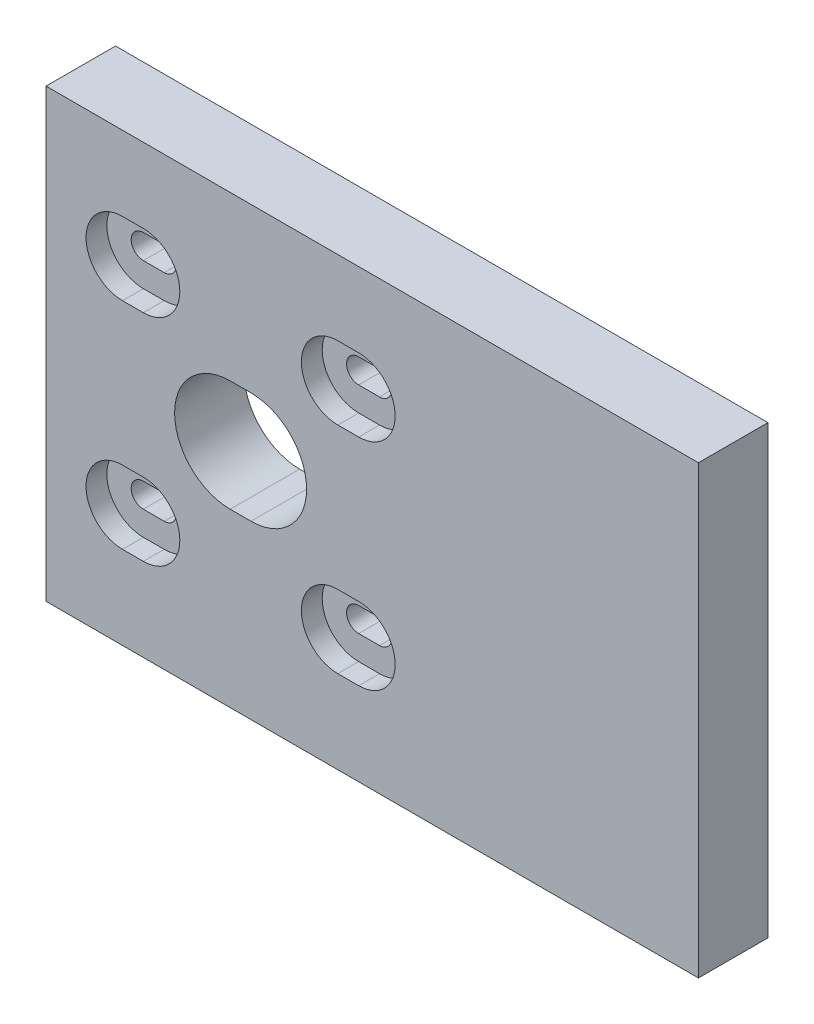
from build123d import *

# Parameters (mm, degrees)
SKETCH1_W           = 93.911938319
SKETCH1_H           = 64.237222829
BOSS_EXTRUDE1_DEPTH = 10
CUT_EXTRUDE1_DEPTH  = 20
CUT_EXTRUDE2_DEPTH  = 3


with BuildPart() as part:
    # Sketch1 → Boss-Extrude1 (new body)
    with BuildSketch(Plane.XY):
        with Locations((-3.99305407, -0.113373268)):
            Rectangle(SKETCH1_W, SKETCH1_H)
    extrude(amount=BOSS_EXTRUDE1_DEPTH)

    # Sketch2 → Cut-Extrude1 (cut)
    with BuildSketch(Plane.XY.offset(10)):
        with BuildLine():
            Line((-39.949023229, 17.755238146), (-36.949023229, 17.755238146))
            ThreePointArc((-36.949023229, 17.755238146), (-35.199023229, 16.005238146), (-36.949023229, 14.255238146))
            Line((-36.949023229, 14.255238146), (-39.949023229, 14.255238146))
            ThreePointArc((-39.949023229, 14.255238146), (-41.699023229, 16.005238146), (-39.949023229, 17.755238146))
        make_face()
        with BuildLine():
            Line((-8.949023229, 17.755238146), (-5.949023229, 17.755238146))
            ThreePointArc((-5.949023229, 17.755238146), (-4.199023229, 16.005238146), (-5.949023229, 14.255238146))
            Line((-5.949023229, 14.255238146), (-8.949023229, 14.255238146))
            ThreePointArc((-8.949023229, 14.255238146), (-10.699023229, 16.005238146), (-8.949023229, 17.755238146))
        make_face()
        with BuildLine():
            Line((-8.949023229, -13.244761854), (-5.949023229, -13.244761854))
            ThreePointArc((-5.949023229, -13.244761854), (-4.199023229, -14.994761854), (-5.949023229, -16.744761854))
            Line((-5.949023229, -16.744761854), (-8.949023229, -16.744761854))
            ThreePointArc((-8.949023229, -16.744761854), (-10.699023229, -14.994761854), (-8.949023229, -13.244761854))
        make_face()
        with BuildLine():
            Line((-39.949023229, -13.244761854), (-36.949023229, -13.244761854))
            ThreePointArc((-36.949023229, -13.244761854), (-35.199023229, -14.994761854), (-36.949023229, -16.744761854))
            Line((-36.949023229, -16.744761854), (-39.949023229, -16.744761854))
            ThreePointArc((-39.949023229, -16.744761854), (-41.699023229, -14.994761854), (-39.949023229, -13.244761854))
        make_face()
        with BuildLine():
            Line((-24.449023229, 8.505238146), (-21.449023229, 8.505238146))
            ThreePointArc((-21.449023229, 8.505238146), (-13.449023229, 0.505238146), (-21.449023229, -7.494761854))
            Line((-21.449023229, -7.494761854), (-24.449023229, -7.494761854))
            ThreePointArc((-24.449023229, -7.494761854), (-32.449023229, 0.505238146), (-24.449023229, 8.505238146))
        make_face()
    extrude(amount=-CUT_EXTRUDE1_DEPTH, mode=Mode.SUBTRACT)

    # Sketch3 → Cut-Extrude2 (cut)
    with BuildSketch(Plane.XY.offset(10)):
        with BuildLine():
            Line((-36.949023229, 21.255238146), (-39.949023229, 21.255238146))
            ThreePointArc((-39.949023229, 21.255238146), (-45.199023229, 16.005238146), (-39.949023229, 10.755238146))
            Line((-39.949023229, 10.755238146), (-36.949023229, 10.755238146))
            ThreePointArc((-36.949023229, 10.755238146), (-31.699023229, 16.005238146), (-36.949023229, 21.255238146))
        make_face()
        with BuildLine():
            Line((-5.949023229, 21.255238146), (-8.949023229, 21.255238146))
            ThreePointArc((-8.949023229, 21.255238146), (-14.199023229, 16.005238146), (-8.949023229, 10.755238146))
            Line((-8.949023229, 10.755238146), (-5.949023229, 10.755238146))
            ThreePointArc((-5.949023229, 10.755238146), (-0.699023229, 16.005238146), (-5.949023229, 21.255238146))
        make_face()
        with BuildLine():
            Line((-5.949023229, -9.744761854), (-8.949023229, -9.744761854))
            ThreePointArc((-8.949023229, -9.744761854), (-14.199023229, -14.994761854), (-8.949023229, -20.244761854))
            Line((-8.949023229, -20.244761854), (-5.949023229, -20.244761854))
            ThreePointArc((-5.949023229, -20.244761854), (-0.699023229, -14.994761854), (-5.949023229, -9.744761854))
        make_face()
        with BuildLine():
            Line((-39.949023229, -20.244761854), (-36.949023229, -20.244761854))
            ThreePointArc((-36.949023229, -20.244761854), (-31.699023229, -14.994761854), (-36.949023229, -9.744761854))
            Line((-36.949023229, -9.744761854), (-39.949023229, -9.744761854))
            ThreePointArc((-39.949023229, -9.744761854), (-45.199023229, -14.994761854), (-39.949023229, -20.244761854))
        make_face()
    extrude(amount=-CUT_EXTRUDE2_DEPTH, mode=Mode.SUBTRACT)


solid = part.part
